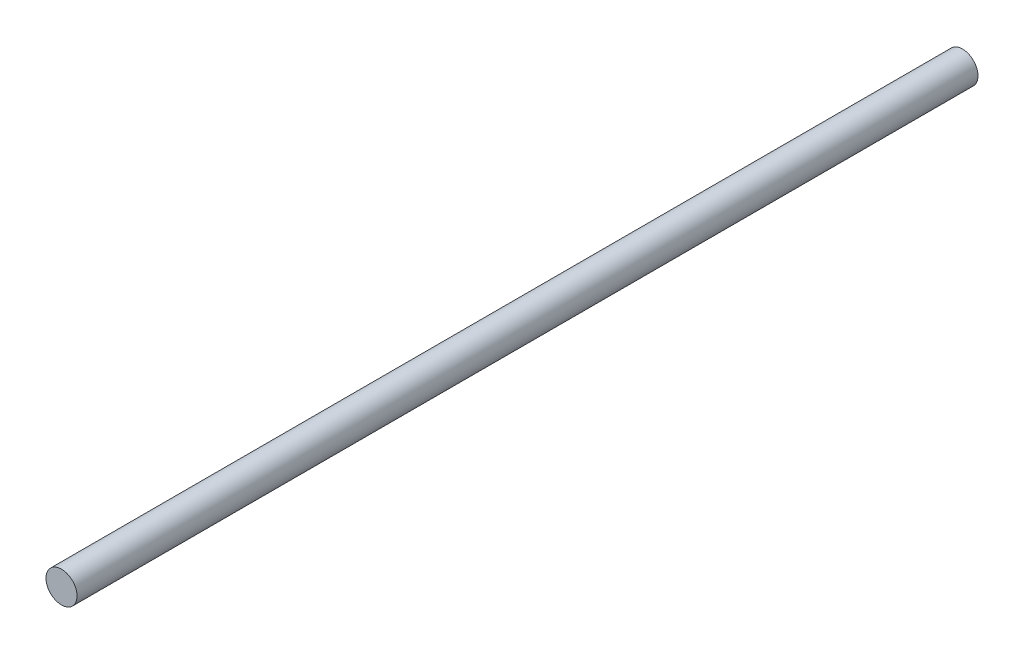
from build123d import *

# Parameters (mm, degrees)
SKETCH1_R           = 12.7
BOSS_EXTRUDE1_DEPTH = 736.6


with BuildPart() as part:
    # Sketch1 → Boss-Extrude1 (new body)
    with BuildSketch(Plane.XY):
        Circle(SKETCH1_R)
    extrude(amount=BOSS_EXTRUDE1_DEPTH)


solid = part.part
